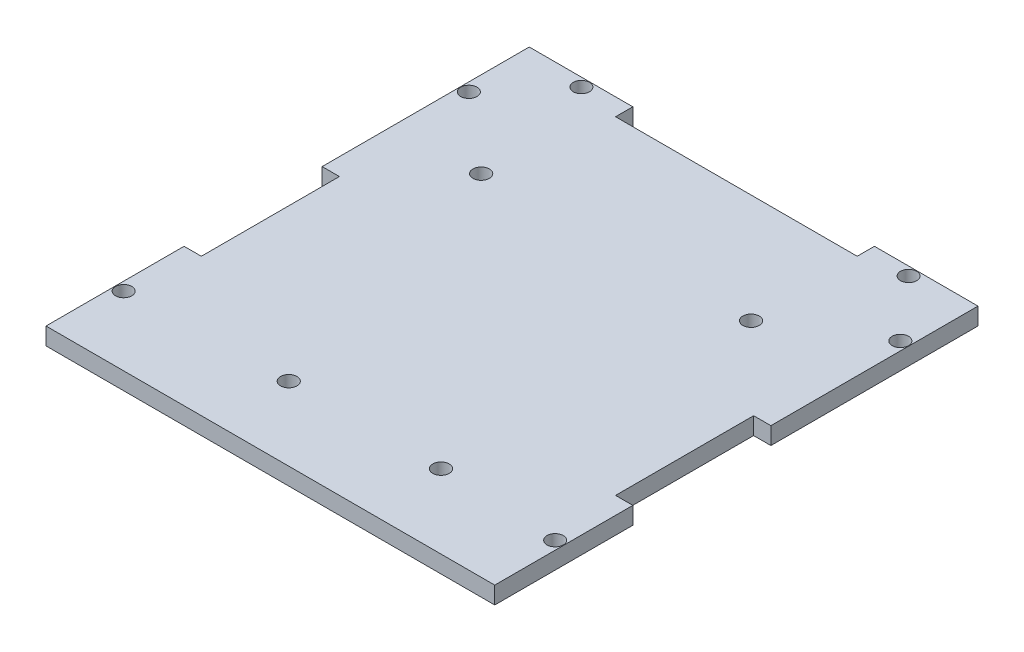
from build123d import *

# Parameters (mm, degrees)
BOSS_EXTRUDE1_DEPTH = 3.175
SKETCH2_R           = 1.5
SKETCH2_R_2         = 1.500000048
CUT_EXTRUDE1_DEPTH  = 99.065877093
SKETCH5_W           = 82.55
SKETCH5_H           = 60.325
CUT_EXTRUDE4_DEPTH  = 99.065877093
SKETCH6_R           = 1.5
CUT_EXTRUDE5_DEPTH  = 99.065877093
SKETCH9_R           = 1.51
CUT_EXTRUDE6_DEPTH  = 99.065877093


with BuildPart() as part:
    # Sketch1 → Boss-Extrude1 (new body)
    with BuildSketch(Plane(origin=(0, 0, 0), x_dir=(1, 0, 0), z_dir=(0, 1, 0))):
        Polygon((-41.275, 0), (-36.368301991, -11.713851401), (-33.466950324, -10.424361771), (-17.857958519, -45.544593333), (-20.759310186, -46.834082962), (-15.601351667, -58.43948963), (-12.7, -60.325), (-5.08, -60.325), (-5.08, -57.15), (5.08, -57.15), (5.08, -60.325), (12.7, -60.325), (15.601351667, -58.43948963), (20.759310186, -46.834082962), (17.857958519, -45.544593333), (33.466950324, -10.424361771), (36.368301991, -11.713851401), (41.275, 0), (41.275, 25.4), (38.1, 25.4), (38.1, 50.8), (41.275, 50.8), (41.275, 88.9), (22.225, 88.9), (22.225, 85.725), (10.205057544, 85.725), (-10.205057544, 85.725), (-22.225, 85.725), (-22.225, 88.9), (-41.275, 88.9), (-41.275, 50.8), (-38.1, 50.8), (-38.1, 25.4), (-41.275, 25.4), align=None)
    extrude(amount=BOSS_EXTRUDE1_DEPTH)

    # Sketch2 → Cut-Extrude1 (cut, through all)
    with BuildSketch(Plane(origin=(0, 0, 0), x_dir=(-1, 0, 0), z_dir=(0, -1, 0))):
        with Locations((39.6875, 76.2)):
            Circle(SKETCH2_R)
        with Locations((-8.89, -58.7375)):
            Circle(SKETCH2_R_2)
        with Locations((39.6875, 12.7)):
            Circle(SKETCH2_R_2)
        with Locations((37.496605417, -5.266403252)):
            Circle(SKETCH2_R_2)
        with Locations((16.729655093, -51.992041481)):
            Circle(SKETCH2_R_2)
        with Locations((8.89, -58.7375)):
            Circle(SKETCH2_R_2)
        with Locations((-16.729655093, -51.992041481)):
            Circle(SKETCH2_R_2)
        with Locations((-37.496605417, -5.266403252)):
            Circle(SKETCH2_R_2)
        with Locations((-39.6875, 12.7)):
            Circle(SKETCH2_R_2)
        with Locations((-39.6875, 76.2)):
            Circle(SKETCH2_R)
    extrude(amount=-CUT_EXTRUDE1_DEPTH, mode=Mode.SUBTRACT)

    # Sketch5 → Cut-Extrude4 (cut, through all)
    with BuildSketch(Plane(origin=(0, 3.175, 0), x_dir=(1, 0, 0), z_dir=(0, 1, 0))):
        with Locations((0, -30.1625)):
            Rectangle(SKETCH5_W, SKETCH5_H)
    extrude(amount=-CUT_EXTRUDE4_DEPTH, mode=Mode.SUBTRACT)

    # Sketch6 → Cut-Extrude5 (cut, through all)
    with BuildSketch(Plane(origin=(0, 3.175, 0), x_dir=(1, 0, 0), z_dir=(0, 1, 0))):
        with Locations((-30.099, 87.3125)):
            Circle(SKETCH6_R)
        with Locations((30.099, 87.3125)):
            Circle(SKETCH6_R)
    extrude(amount=-CUT_EXTRUDE5_DEPTH, mode=Mode.SUBTRACT)

    # Sketch9 → Cut-Extrude6 (cut, through all)
    with BuildSketch(Plane(origin=(0, 3.175, 0), x_dir=(1, 0, 0), z_dir=(0, 1, 0))):
        with Locations((17.783556068, 13.6042895)):
            Circle(SKETCH9_R)
        with Locations((-10.156362029, 13.536637817)):
            Circle(SKETCH9_R)
        with Locations((-25.519320413, 64.299587984)):
            Circle(SKETCH9_R)
        with Locations((22.737463041, 65.686437168)):
            Circle(SKETCH9_R)
    extrude(amount=-CUT_EXTRUDE6_DEPTH, mode=Mode.SUBTRACT)


solid = part.part
